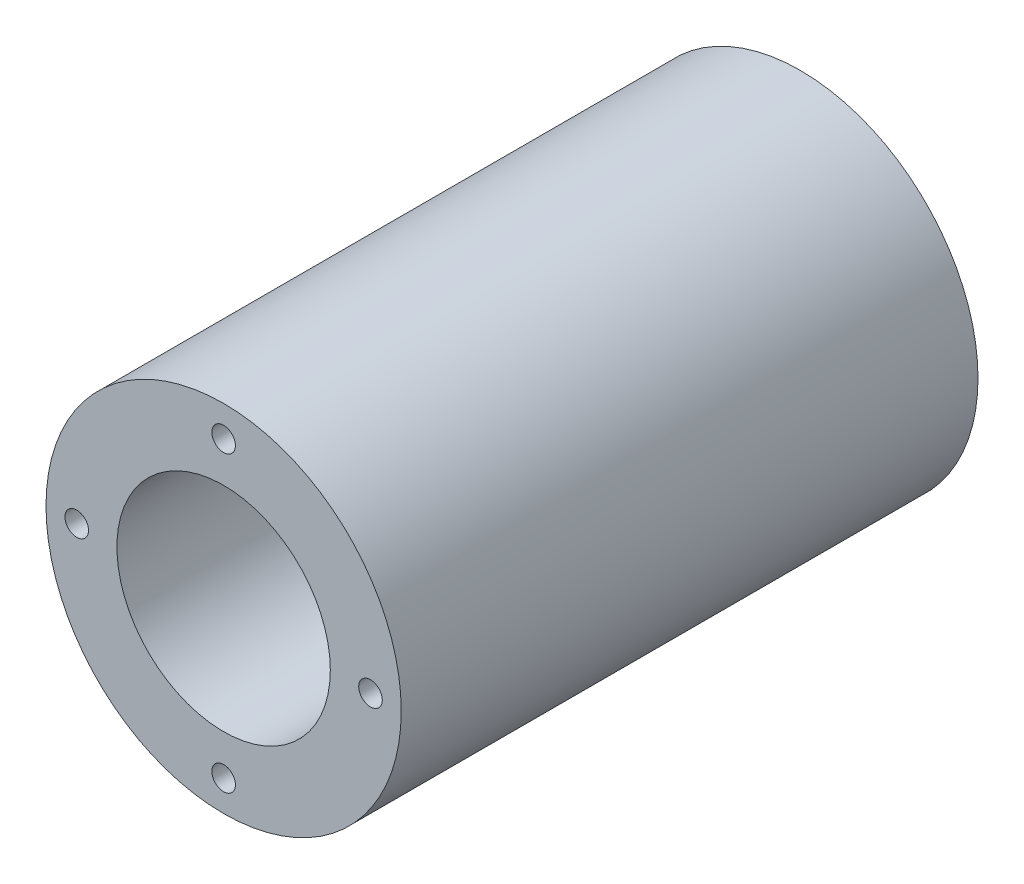
from build123d import *

# Parameters (mm, degrees)
SKETCH1_W              = 122.25900037
SKETCH1_H              = 15.03045
BACKFACEPATTERN_COUNT  = 6
FRONTFACEPATTERN_COUNT = 4
SKETCH7_R              = 26.9875
SKETCH7_R_2            = 24.60625
CUT_EXTRUDE1_DEPTH     = 0.5


with BuildPart() as part:
    # Sketch1 → Revolve1 (revolve)
    with BuildSketch(Plane(origin=(0, 0, 0), x_dir=(0, 0, -1), z_dir=(1, 0, 0))):
        with Locations((-86.754500084, 30.133925)):
            Rectangle(SKETCH1_W, SKETCH1_H)
    revolve(axis=Axis((0, 0, 147.884000269), (0, 0, -1)))

    # Sketch9 → M6x1.0 Tapped Hole3 (revolve, cut)
    with BuildSketch(Plane(origin=(0, 31.133925032, 25.624999899), x_dir=(0, 1, 0), z_dir=(1, 0, 0))):
        Polygon((0, 0), (0, 16.502151548), (2.5, 15), (2.5, 0), align=None)
    m6x1_0_tapped_hole3 = revolve(axis=Axis((0, 31.133925032, 19.274999899), (0, 0, 1)), mode=Mode.SUBTRACT)

    # BackFacePattern: M6x1.0 Tapped Hole3 ×6 about axis
    backfacepattern_axis = Axis((0, 0, 1000), (0, 0, -1))
    for i in range(1, BACKFACEPATTERN_COUNT):
        add(m6x1_0_tapped_hole3.rotate(backfacepattern_axis, i * 360 / BACKFACEPATTERN_COUNT), mode=Mode.SUBTRACT)

    # Sketch6 → M6x1.0 Tapped Hole2 (revolve, cut)
    with BuildSketch(Plane(origin=(0, 31.133925032, 147.884000269), x_dir=(0, -1, 0), z_dir=(1, 0, 0))):
        Polygon((0, 0), (0, 16.502151548), (2.5, 15), (2.5, 0), align=None)
    m6x1_0_tapped_hole2 = revolve(axis=Axis((0, 31.133925032, 154.234000269), (0, 0, -1)), mode=Mode.SUBTRACT)

    # FrontFacePattern: M6x1.0 Tapped Hole2 ×4 about axis
    frontfacepattern_axis = Axis((0, 0, 1000), (0, 0, -1))
    for i in range(1, FRONTFACEPATTERN_COUNT):
        add(m6x1_0_tapped_hole2.rotate(frontfacepattern_axis, i * 360 / FRONTFACEPATTERN_COUNT), mode=Mode.SUBTRACT)

    # Sketch7 → Cut-Extrude1 (cut)
    with BuildSketch(Plane(origin=(0, 0, 25.624999899), x_dir=(-1, 0, 0), z_dir=(0, 0, -1))):
        Circle(SKETCH7_R)
        Circle(SKETCH7_R_2, mode=Mode.SUBTRACT)
    extrude(amount=-CUT_EXTRUDE1_DEPTH, mode=Mode.SUBTRACT)


solid = part.part
